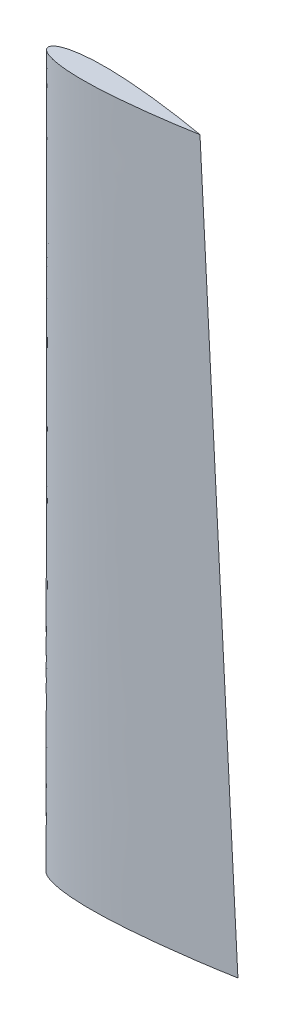
from build123d import *


with BuildPart() as part:
    # rootSketch → Loft1 section 0
    with BuildSketch(Plane(origin=(0, 0, 0), x_dir=(1, 0, 0), z_dir=(0, 1, 0))):
        with BuildLine():
            add(Edge.make_bspline(
                [(0, 0), (-1.6572e-05, 0.056577364), (0.005364667, 0.148026672), (0.026073501, 0.280241396), (0.077769955, 0.452215412), (0.147060273, 0.611874915), (0.248525433, 0.785971359), (0.39236103, 0.977542518), (0.599181982, 1.195423819), (0.905829823, 1.451816919), (1.370469676, 1.757918922), (2.078266075, 2.119108524), (3.175731681, 2.542039428), (4.823252293, 2.99869744), (7.275411011, 3.452976612), (10.438659341, 3.780475746), (14.129329887, 3.929259057), (18.143568779, 3.896250983), (22.151742679, 3.722301475), (25.656241741, 3.475962342), (28.651461505, 3.213566971), (31.650711737, 2.914013348), (34.134157887, 2.639630917), (36.639458817, 2.336640809), (39.599525944, 1.953685828), (42.127939329, 1.60070159), (44.533194308, 1.24753169), (47.121130826, 0.837424538), (48.910319544, 0.545474341), (50.6553202, 0.241362714), (51.550989041, 0.081579679), (52, 0)],
                knots=[0, 0, 0, 0, 0, 0.003840944, 0.006235023, 0.009072291, 0.01219322, 0.015656839, 0.019917177, 0.025338962, 0.032592504, 0.042799388, 0.05770457, 0.079310668, 0.112503101, 0.158972616, 0.227236465, 0.295500326, 0.36376419, 0.432028053, 0.500291915, 0.534423847, 0.56855578, 0.636819643, 0.670951575, 0.705083508, 0.773347371, 0.807479302, 0.841611234, 0.875743167, 0.9098751, 0.9098751, 0.9098751, 0.9098751, 0.9098751], degree=4))
            add(Edge.make_bspline(
                [(0, 0), (-1.6572e-05, -0.056577364), (0.005364667, -0.148026672), (0.026073501, -0.280241396), (0.077769955, -0.452215412), (0.147060273, -0.611874915), (0.248525433, -0.785971359), (0.39236103, -0.977542518), (0.599181982, -1.195423819), (0.905829823, -1.451816919), (1.370469676, -1.757918922), (2.078266075, -2.119108524), (3.175731681, -2.542039428), (4.823252293, -2.99869744), (7.275411011, -3.452976612), (10.438659341, -3.780475746), (14.129329887, -3.929259057), (18.143568779, -3.896250983), (22.151742679, -3.722301475), (25.656241741, -3.475962342), (28.651461505, -3.213566971), (31.650711737, -2.914013348), (34.134157887, -2.639630917), (36.639458817, -2.336640809), (39.599525944, -1.953685828), (42.127939329, -1.60070159), (44.533194308, -1.24753169), (47.121130826, -0.837424538), (48.910319544, -0.545474341), (50.6553202, -0.241362714), (51.550989041, -0.081579679), (52, 0)],
                knots=[0, 0, 0, 0, 0, 0.003840944, 0.006235023, 0.009072291, 0.01219322, 0.015656839, 0.019917177, 0.025338962, 0.032592504, 0.042799388, 0.05770457, 0.079310668, 0.112503101, 0.158972616, 0.227236465, 0.295500326, 0.36376419, 0.432028053, 0.500291915, 0.534423847, 0.56855578, 0.636819643, 0.670951575, 0.705083508, 0.773347371, 0.807479302, 0.841611234, 0.875743167, 0.9098751, 0.9098751, 0.9098751, 0.9098751, 0.9098751], degree=4))
        make_face()
    # tipSketch → Loft1 section 1
    with BuildSketch(Plane(origin=(0, 195.00156, 0), x_dir=(1, 0, 0), z_dir=(0, 1, 0))):
        with BuildLine():
            add(Edge.make_bspline(
                [(0, 0), (-1.3258e-05, 0.045261891), (0.004291734, 0.118421337), (0.020858801, 0.224193117), (0.062215964, 0.36177233), (0.117648218, 0.489499932), (0.198820346, 0.628777088), (0.313888824, 0.782034014), (0.479345586, 0.956339056), (0.724663859, 1.161453535), (1.096375741, 1.406335137), (1.66261286, 1.695286819), (2.540585345, 2.033631542), (3.858601834, 2.398957952), (5.820328809, 2.762381289), (8.350927473, 3.024380597), (11.30346391, 3.143407246), (14.514855023, 3.117000787), (17.721394143, 2.97784118), (20.524993393, 2.780769874), (22.921169204, 2.570853577), (25.320569389, 2.331210679), (27.307326309, 2.111704734), (29.311567053, 1.869312647), (31.679620755, 1.562948662), (33.702351463, 1.280561272), (35.626555447, 0.998025352), (37.696904661, 0.66993963), (39.128255635, 0.436379473), (40.52425616, 0.193090171), (41.240791233, 0.065263743), (41.6, 0)],
                knots=[0, 0, 0, 0, 0, 0.003840944, 0.006235023, 0.009072291, 0.01219322, 0.015656839, 0.019917177, 0.025338962, 0.032592504, 0.042799388, 0.05770457, 0.079310668, 0.112503101, 0.158972616, 0.227236465, 0.295500326, 0.36376419, 0.432028053, 0.500291915, 0.534423847, 0.56855578, 0.636819643, 0.670951575, 0.705083508, 0.773347371, 0.807479302, 0.841611234, 0.875743167, 0.9098751, 0.9098751, 0.9098751, 0.9098751, 0.9098751], degree=4))
            add(Edge.make_bspline(
                [(0, 0), (-1.3258e-05, -0.045261891), (0.004291734, -0.118421337), (0.020858801, -0.224193117), (0.062215964, -0.36177233), (0.117648218, -0.489499932), (0.198820346, -0.628777088), (0.313888824, -0.782034014), (0.479345586, -0.956339056), (0.724663859, -1.161453535), (1.096375741, -1.406335137), (1.66261286, -1.695286819), (2.540585345, -2.033631542), (3.858601834, -2.398957952), (5.820328809, -2.762381289), (8.350927473, -3.024380597), (11.30346391, -3.143407246), (14.514855023, -3.117000787), (17.721394143, -2.97784118), (20.524993393, -2.780769874), (22.921169204, -2.570853577), (25.320569389, -2.331210679), (27.307326309, -2.111704734), (29.311567053, -1.869312647), (31.679620755, -1.562948662), (33.702351463, -1.280561272), (35.626555447, -0.998025352), (37.696904661, -0.66993963), (39.128255635, -0.436379473), (40.52425616, -0.193090171), (41.240791233, -0.065263743), (41.6, 0)],
                knots=[0, 0, 0, 0, 0, 0.003840944, 0.006235023, 0.009072291, 0.01219322, 0.015656839, 0.019917177, 0.025338962, 0.032592504, 0.042799388, 0.05770457, 0.079310668, 0.112503101, 0.158972616, 0.227236465, 0.295500326, 0.36376419, 0.432028053, 0.500291915, 0.534423847, 0.56855578, 0.636819643, 0.670951575, 0.705083508, 0.773347371, 0.807479302, 0.841611234, 0.875743167, 0.9098751, 0.9098751, 0.9098751, 0.9098751, 0.9098751], degree=4))
        make_face()
    loft()


solid = part.part
